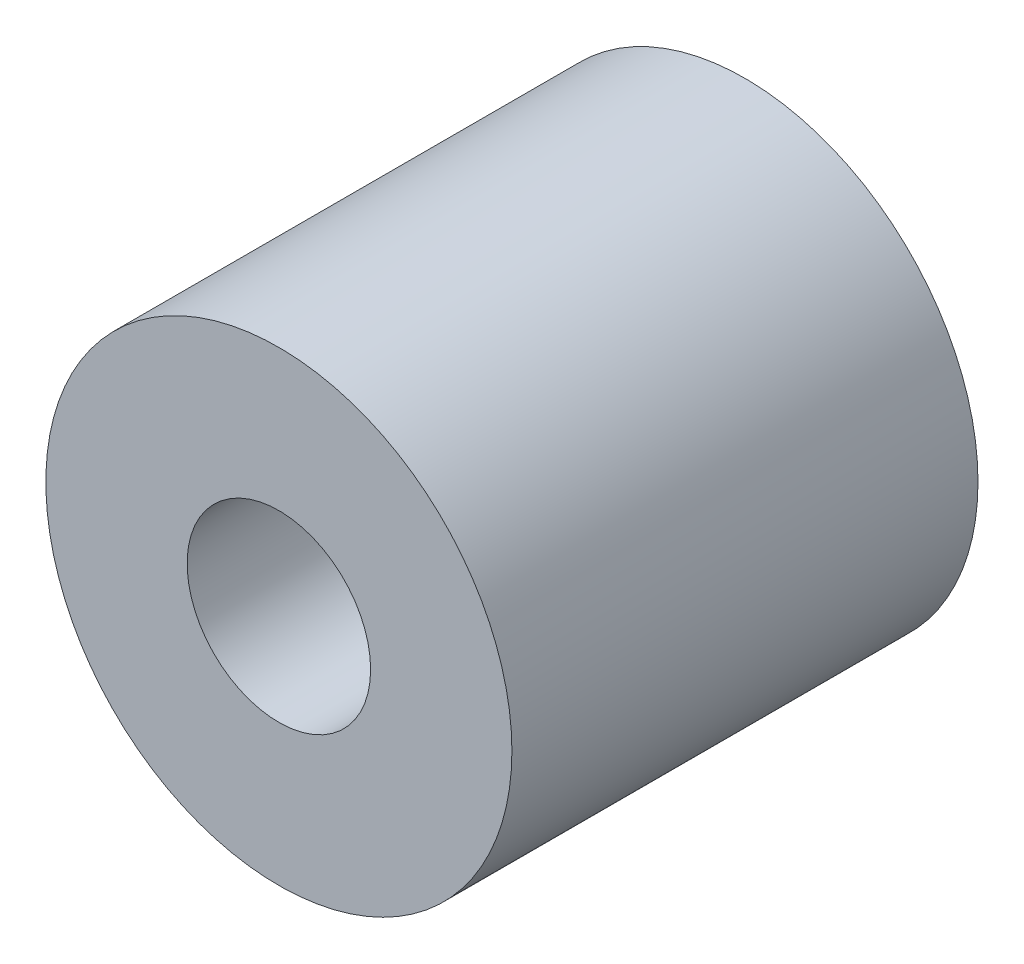
from build123d import *

# Parameters (mm, degrees)
SKETCH1_R           = 6.35
SKETCH1_R_2         = 2.499995
BOSS_EXTRUDE1_DEPTH = 12.7


with BuildPart() as part:
    # Sketch1 → Boss-Extrude1 (new body)
    with BuildSketch(Plane.XY):
        Circle(SKETCH1_R)
        Circle(SKETCH1_R_2, mode=Mode.SUBTRACT)
    extrude(amount=BOSS_EXTRUDE1_DEPTH)


solid = part.part
